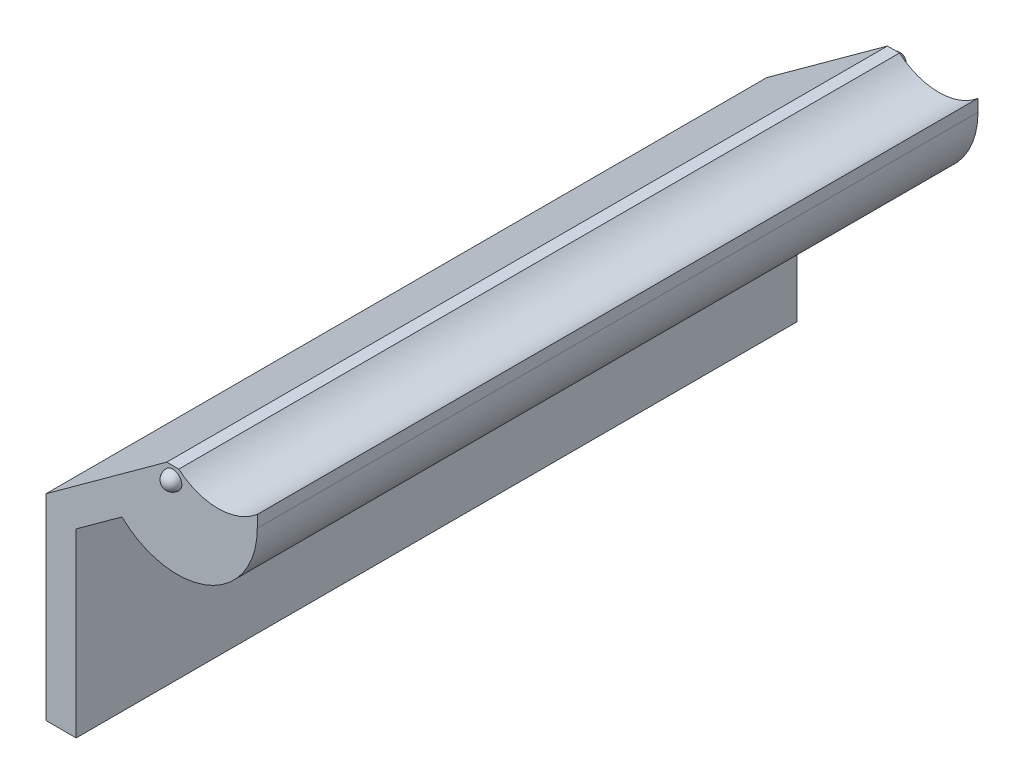
from build123d import *

# Parameters (mm, degrees)
BOSS_EXTRUDE1_DEPTH = 75.819


with BuildPart() as part:
    # Sketch1 → Boss-Extrude1 (new, symmetric)
    with BuildSketch(Plane.XY):
        with BuildLine():
            Line((-19.05, -41.467593741), (-9.420197001, -34.471132327))
            ThreePointArc((-9.420197001, -34.471132327), (8.828045853, -37.79575396), (19.05, -22.317926926))
            Line((19.05, -22.317926926), (19.05, -19.777926926))
            ThreePointArc((19.05, -19.777926926), (10.795, -22.826762488), (2.54, -19.777926926))
            Line((2.54, -19.777926926), (0, -19.777926926))
            Line((0, -19.777926926), (-25.4, -38.232107137))
            Line((-25.4, -38.232107137), (-25.4, -79.567593741))
            Line((-25.4, -79.567593741), (-19.05, -79.567593741))
            Line((-19.05, -79.567593741), (-19.05, -41.467593741))
        make_face()
    extrude(amount=BOSS_EXTRUDE1_DEPTH, both=True)

    # Sketch2 → Revolve1 (revolve)
    with BuildSketch(Plane.XY.offset(75.819)):
        with BuildLine():
            Line((1.27, -20.412926926), (1.27, -24.222926926))
            ThreePointArc((1.27, -24.222926926), (3.175, -22.317926926), (1.27, -20.412926926))
        make_face()
    revolve(axis=Axis((1.27, -20.412926926, 75.819), (0, -1, 0)))

    # Sketch3 → Revolve2 (revolve)
    with BuildSketch(Plane(origin=(0, 0, -75.819), x_dir=(-1, 0, 0), z_dir=(0, 0, -1))):
        with BuildLine():
            Line((-1.27, -20.412926926), (-1.27, -24.222926926))
            ThreePointArc((-1.27, -24.222926926), (0.635, -22.317926926), (-1.27, -20.412926926))
        make_face()
    revolve(axis=Axis((1.27, -20.412926926, -75.819), (0, -1, 0)))


solid = part.part
